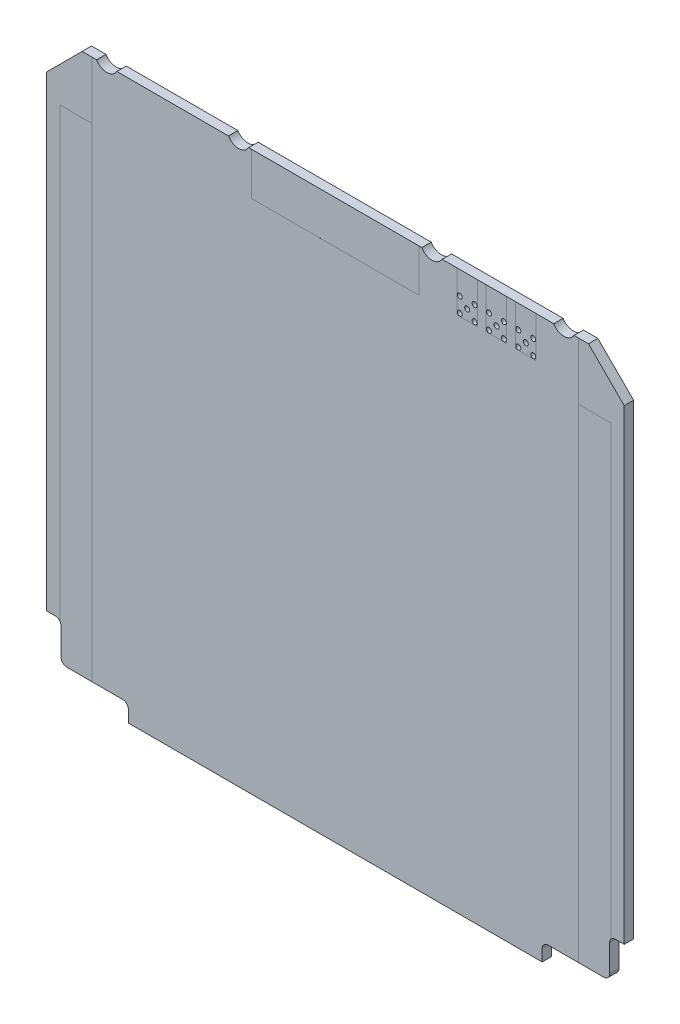
from build123d import *

# Parameters (mm, degrees)
SKETCH1_W                         = 98.6
SKETCH1_H                         = 95.3
BASICSIZE_DEPTH                   = 1.6
CHAMFER1_SIZE                     = 6.1
BACKPLANESIDESCREWCUTOUT_DEPTH    = 71.235674696
LPATTERN3_COUNT                   = 2
LPATTERN3_PITCH                   = 22.5
MIRROR3_COPY_1_DEPTH              = 71.235674696
MIRROR3_COPY_2_DEPTH              = 71.235674696
CUT_EXTRUDE4_DEPTH                = 71.235674696
FILLET1_R                         = 1
FILLET1_OF_MIRROR1_R              = 1
SKETCH5_R                         = 0.425
CUT_EXTRUDE3_DEPTH                = 71.235674696
LPATTERN2_COUNT                   = 3
LPATTERN2_PITCH                   = 5
PARTFOOTPRINTS_W                  = 3.5
PARTFOOTPRINTS_H                  = 6.95
MMCXFOOTPRINT_DEPTH               = 0.0001
SKETCH7_W                         = 28.575
SKETCH7_H                         = 7.293
TIGEREYEFOOTPRINT_DEPTH           = 0.0001
KEEPOUT_BOTTOM_DEPTH              = 0.0001
CAUTION_TOP_START                 = -0.00015
CAUTION_TOP_DEPTH                 = 0.00015
CLEARANCES_SIDE_SIDE_COPY_1_DEPTH = 0.0001
CLEARANCES_SIDE_SIDE_START        = -0.00015
CLEARANCES_SIDE_SIDE_COPY_2_DEPTH = 0.00015
CLEARANCES_SIDE_SIDE_COPY_3_DEPTH = 0.0001
CLEARANCES_SIDE_SIDE_COPY_4_DEPTH = 0.00015


with BuildPart() as part:
    # Sketch1 → basicSize (new body)
    with BuildSketch(Plane(origin=(0, 0, -0.0125), x_dir=(-1, 0, 0), z_dir=(0, 0, -1))):
        with Locations((0, -2.35)):
            Rectangle(SKETCH1_W, SKETCH1_H)
    extrude(amount=-BASICSIZE_DEPTH)

    # Chamfer1
    chamfer1_edges = [part.edges().sort_by_distance(p)[0] for p in [
        (49.3, 45.3, 0.7875),
        (-49.3, 45.3, 0.7875),
    ]]
    chamfer(chamfer1_edges, length=CHAMFER1_SIZE)

    # Sketch4 → backplaneSideScrewCutout (cut, symmetric)
    with BuildSketch(Plane.XY.offset(1.5875)):
        with BuildLine():
            Line((37.267949192, 45.3), (40.732050808, 45.3))
            ThreePointArc((40.732050808, 45.3), (39, 44.3), (37.267949192, 45.3))
        make_face()
    backplanesidescrewcutout = extrude(amount=BACKPLANESIDESCREWCUTOUT_DEPTH, both=True, mode=Mode.SUBTRACT)

    # LPattern3: backplaneSideScrewCutout ×2
    with Locations(*[(-i * LPATTERN3_PITCH, 0, 0) for i in range(1, LPATTERN3_COUNT)]):
        add(backplanesidescrewcutout, mode=Mode.SUBTRACT)

    # Mirror3 copy 1 sketch → Mirror3 copy 1 (cut, symmetric)
    with BuildSketch(Plane(origin=(22.5, 0, 1.5875), x_dir=(-1, 0, 0), z_dir=(0, 0, 1))):
        with BuildLine():
            Line((37.267949192, -45.3), (40.732050808, -45.3))
            ThreePointArc((40.732050808, -45.3), (39, -44.3), (37.267949192, -45.3))
        make_face()
    extrude(amount=MIRROR3_COPY_1_DEPTH, both=True, mode=Mode.SUBTRACT)

    # Mirror3 copy 2 sketch → Mirror3 copy 2 (cut, symmetric)
    with BuildSketch(Plane(origin=(0, 0, 1.5875), x_dir=(-1, 0, 0), z_dir=(0, 0, 1))):
        with BuildLine():
            Line((37.267949192, -45.3), (40.732050808, -45.3))
            ThreePointArc((40.732050808, -45.3), (39, -44.3), (37.267949192, -45.3))
        make_face()
    extrude(amount=MIRROR3_COPY_2_DEPTH, both=True, mode=Mode.SUBTRACT)

    # Sketch6 → Cut-Extrude4 (cut, through all)
    with BuildSketch(Plane.XY.offset(1.5875)):
        Polygon((-49.3, -40.4), (-46.8, -40.4), (-46.8, -47), (-35.3, -47), (-35.3, -50), (-49.3, -50), align=None)
    cut_extrude4 = extrude(amount=-CUT_EXTRUDE4_DEPTH, mode=Mode.SUBTRACT)

    # Fillet1
    fillet1_edges = [part.edges().sort_by_distance(p)[0] for p in [
        (-35.3, -47, 0.7875),
        (-46.8, -47, 0.7875),
        (-46.8, -40.4, 0.7875),
    ]]
    fillet(fillet1_edges, radius=FILLET1_R)

    # Mirror1: Cut-Extrude4 across plane
    add(cut_extrude4.mirror(Plane(origin=(0, 0, 0), x_dir=(0, 0, 1), z_dir=(1, 0, 0))), mode=Mode.SUBTRACT)

    # Fillet1 of Mirror1
    fillet1_of_mirror1_edges = [part.edges().sort_by_distance(p)[0] for p in [
        (35.3, -47, 0.7875),
        (46.8, -47, 0.7875),
        (46.8, -40.4, 0.7875),
    ]]
    fillet(fillet1_of_mirror1_edges, radius=FILLET1_OF_MIRROR1_R)

    # Sketch5 → Cut-Extrude3 (cut, through all)
    with BuildSketch(Plane.XY.offset(1.5875)):
        with Locations((22.5, 40.1)):
            Circle(SKETCH5_R)
        with Locations((21.23, 41.37)):
            Circle(SKETCH5_R)
        with Locations((21.23, 38.83)):
            Circle(SKETCH5_R)
        with Locations((23.77, 41.37)):
            Circle(SKETCH5_R)
        with Locations((23.77, 38.83)):
            Circle(SKETCH5_R)
    cut_extrude3 = extrude(amount=-CUT_EXTRUDE3_DEPTH, mode=Mode.SUBTRACT)

    # LPattern2: Cut-Extrude3 ×3
    with Locations(*[(i * LPATTERN2_PITCH, 0, 0) for i in range(1, LPATTERN2_COUNT)]):
        add(cut_extrude3, mode=Mode.SUBTRACT)

    # partFootprints → MMCXfootprint (cut)
    with BuildSketch(Plane.XY.offset(1.5875)):
        with Locations((22.5, 41.825)):
            Rectangle(PARTFOOTPRINTS_W, PARTFOOTPRINTS_H)
        with Locations((27.5, 41.825)):
            Rectangle(PARTFOOTPRINTS_W, PARTFOOTPRINTS_H)
        with Locations((32.5, 41.825)):
            Rectangle(PARTFOOTPRINTS_W, PARTFOOTPRINTS_H)
    extrude(amount=-MMCXFOOTPRINT_DEPTH, mode=Mode.SUBTRACT)

    # Sketch7 → TigerEyeFootprint (cut)
    with BuildSketch(Plane.XY.offset(1.5875)):
        with Locations((0, 41.6535)):
            Rectangle(SKETCH7_W, SKETCH7_H)
    extrude(amount=-TIGEREYEFOOTPRINT_DEPTH, mode=Mode.SUBTRACT)

    # thermalContacts_upper → keepOut_bottom (cut)
    with BuildSketch(Plane.XY.offset(1.5875)):
        Polygon((-47, 35.5), (-47, -41.5), (-56.192158269, -41.5), (-56.192158269, 47), (-41.5, 47), (-41.5, 35.5), align=None)
    keepout_bottom = extrude(amount=-KEEPOUT_BOTTOM_DEPTH, mode=Mode.SUBTRACT)

    # Sketch3 → caution_top (cut)
    with BuildSketch(Plane.XY.offset(1.5875).offset(CAUTION_TOP_START)):
        with BuildLine():
            Line((-41.5, 35.5), (-47, 35.5))
            Line((-47, 35.5), (-47, -40.8))
            ThreePointArc((-47, -40.8), (-46.851316702, -41.083772234), (-46.8, -41.4))
            Line((-46.8, -41.4), (-46.8, -46))
            ThreePointArc((-46.8, -46), (-46.507106781, -46.707106781), (-45.8, -47))
            Line((-45.8, -47), (-41.5, -47))
            Line((-41.5, -47), (-41.5, 35.5))
        make_face()
    caution_top = extrude(amount=CAUTION_TOP_DEPTH, mode=Mode.SUBTRACT)

    # clearances_top-bottom: keepOut_bottom, caution_top across plane
    add(keepout_bottom.mirror(Plane.XY.offset(0.7875)), mode=Mode.SUBTRACT)
    add(caution_top.mirror(Plane.XY.offset(0.7875)), mode=Mode.SUBTRACT)

    # clearances_side-side copy 1 sketch → clearances_side-side copy 1 (cut)
    with BuildSketch(Plane(origin=(0, 0, -0.0125), x_dir=(-1, 0, 0), z_dir=(0, 0, -1))):
        Polygon((-47, 35.5), (-47, -41.5), (-56.192158269, -41.5), (-56.192158269, 47), (-41.5, 47), (-41.5, 35.5), align=None)
    extrude(amount=-CLEARANCES_SIDE_SIDE_COPY_1_DEPTH, mode=Mode.SUBTRACT)

    # clearances_side-side copy 2 sketch → clearances_side-side copy 2 (cut)
    with BuildSketch(Plane(origin=(0, 0, -0.0125), x_dir=(-1, 0, 0), z_dir=(0, 0, -1)).offset(CLEARANCES_SIDE_SIDE_START)):
        with BuildLine():
            Line((-41.5, 35.5), (-47, 35.5))
            Line((-47, 35.5), (-47, -40.8))
            ThreePointArc((-47, -40.8), (-46.851316702, -41.083772234), (-46.8, -41.4))
            Line((-46.8, -41.4), (-46.8, -46))
            ThreePointArc((-46.8, -46), (-46.507106781, -46.707106781), (-45.8, -47))
            Line((-45.8, -47), (-41.5, -47))
            Line((-41.5, -47), (-41.5, 35.5))
        make_face()
    extrude(amount=CLEARANCES_SIDE_SIDE_COPY_2_DEPTH, mode=Mode.SUBTRACT)

    # clearances_side-side copy 3 sketch → clearances_side-side copy 3 (cut)
    with BuildSketch(Plane(origin=(0, 0, 1.5875), x_dir=(-1, 0, 0), z_dir=(0, 0, 1))):
        Polygon((-47, -35.5), (-47, 41.5), (-56.192158269, 41.5), (-56.192158269, -47), (-41.5, -47), (-41.5, -35.5), align=None)
    extrude(amount=-CLEARANCES_SIDE_SIDE_COPY_3_DEPTH, mode=Mode.SUBTRACT)

    # clearances_side-side copy 4 sketch → clearances_side-side copy 4 (cut)
    with BuildSketch(Plane(origin=(0, 0, 1.5875), x_dir=(-1, 0, 0), z_dir=(0, 0, 1)).offset(CLEARANCES_SIDE_SIDE_START)):
        with BuildLine():
            Line((-41.5, -35.5), (-47, -35.5))
            Line((-47, -35.5), (-47, 40.8))
            ThreePointArc((-47, 40.8), (-46.851316702, 41.083772234), (-46.8, 41.4))
            Line((-46.8, 41.4), (-46.8, 46))
            ThreePointArc((-46.8, 46), (-46.507106781, 46.707106781), (-45.8, 47))
            Line((-45.8, 47), (-41.5, 47))
            Line((-41.5, 47), (-41.5, -35.5))
        make_face()
    extrude(amount=CLEARANCES_SIDE_SIDE_COPY_4_DEPTH, mode=Mode.SUBTRACT)


solid = part.part
